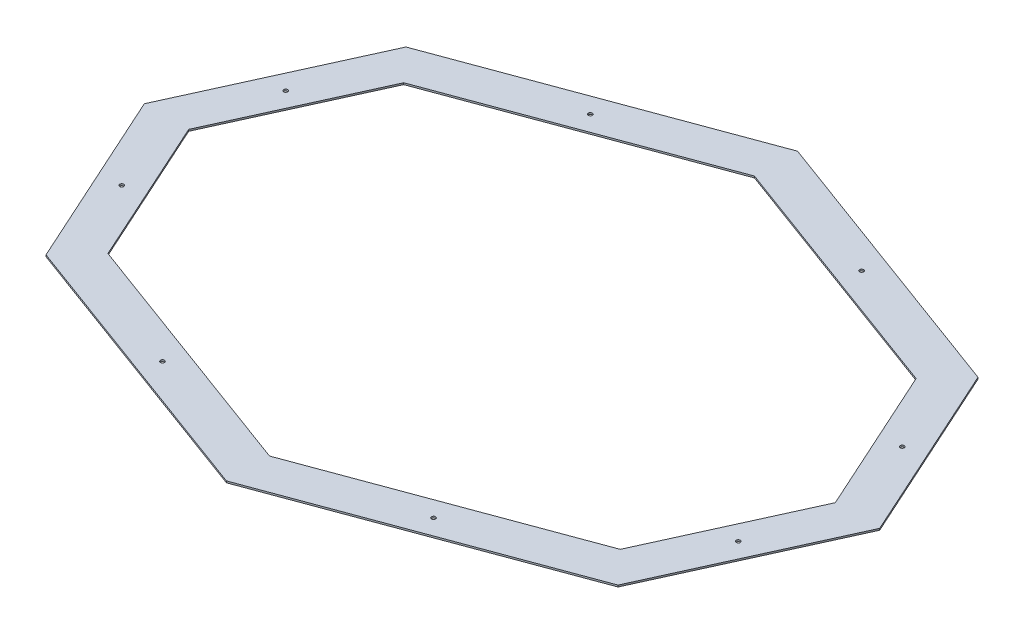
from build123d import *

# Parameters (mm, degrees)
BOSS_EXTRUDE1_DEPTH     = 1.5875
CUT_EXTRUDE1_DEPTH      = 878.803533207
CUT_EXTRUDE1_DEPTH_BACK = 878.803533207
SKETCH3_R               = 3.81


with BuildPart() as part:
    # Sketch2 → Boss-Extrude1 (new, symmetric)
    with BuildSketch(Plane(origin=(0, 0, 0), x_dir=(1, 0, 0), z_dir=(0, 1, 0))):
        Polygon((-539.291607309, 339.354663964), (0, 538.425777574), (539.291607309, 339.354663964), (693.277869831, 0), (539.291607309, -339.354663964), (0, -538.425777574), (-539.291607309, -339.354663964), (-693.277869831, 0), align=None)
        Polygon((-609.6, 0), (-483.050585246, 278.889385424), (0, 457.2), (483.050585246, 278.889385424), (609.6, 0), (483.050585246, -278.889385424), (0, -457.2), (-483.050585246, -278.889385424), align=None, mode=Mode.SUBTRACT)
    extrude(amount=BOSS_EXTRUDE1_DEPTH, both=True)

    # Sketch3 → Cut-Extrude1 (cut, two sides: drawn at the far end of the back side and taken through both)
    with BuildSketch(Plane(origin=(0, 0, 0), x_dir=(1, 0, 0), z_dir=(0, 1, 0)).offset(-CUT_EXTRUDE1_DEPTH_BACK)):
        with Locations((581.305015597, 154.561012347)):
            Circle(SKETCH3_R)
        with Locations((581.305015597, -154.561012347)):
            Circle(SKETCH3_R)
        with Locations((-581.305015597, -154.561012347)):
            Circle(SKETCH3_R)
        with Locations((-581.305015597, 154.561012347)):
            Circle(SKETCH3_R)
        with Locations((-255.585548139, 403.467456741)):
            Circle(SKETCH3_R)
        with Locations((255.585548139, 403.467456741)):
            Circle(SKETCH3_R)
        with Locations((255.585548139, -403.467456741)):
            Circle(SKETCH3_R)
        with Locations((-255.585548139, -403.467456741)):
            Circle(SKETCH3_R)
    extrude(amount=CUT_EXTRUDE1_DEPTH + CUT_EXTRUDE1_DEPTH_BACK, mode=Mode.SUBTRACT)


solid = part.part
